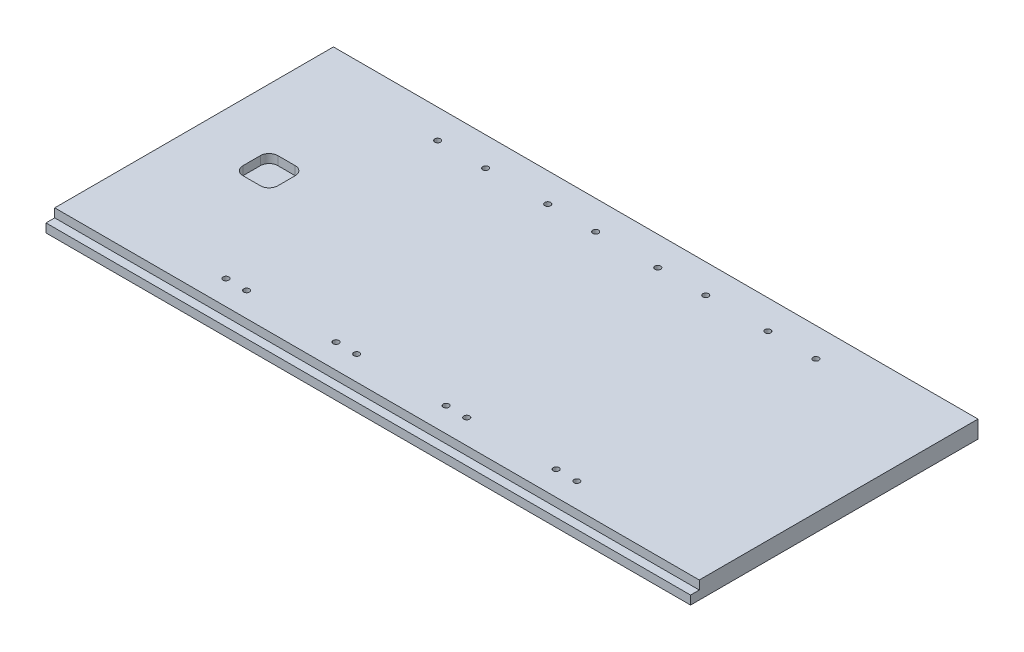
from build123d import *

# Parameters (mm, degrees)
SKETCH3_W           = 469.9
SKETCH3_H           = 209.55
BOSS_EXTRUDE1_DEPTH = 12.7
SKETCH4_R           = 2.1
CUT_EXTRUDE3_DEPTH  = 258.566677047
SKETCH5_R           = 2.1
CUT_EXTRUDE4_DEPTH  = 258.566677047
SKETCH7_W           = 25.4
SKETCH7_H           = 25.4
CUT_EXTRUDE5_DEPTH  = 6.35
CUT_EXTRUDE6_REACH  = 483.607
SKETCH8_W           = 6.35
SKETCH8_H           = 6.35
FILLET1_R           = 6.35


with BuildPart() as part:
    # Sketch3 → Boss-Extrude1 (new body)
    with BuildSketch(Plane(origin=(0, 0, 0), x_dir=(1, 0, 0), z_dir=(0, 1, 0))):
        Rectangle(SKETCH3_W, SKETCH3_H)
    extrude(amount=BOSS_EXTRUDE1_DEPTH)

    # Sketch4 → Cut-Extrude3 (cut, through all)
    with BuildSketch(Plane(origin=(0, 12.7, 0), x_dir=(1, 0, 0), z_dir=(0, 1, 0))):
        with Locations((-102.9, 83.65)):
            Circle(SKETCH4_R)
        with Locations((-22.65, 83.65)):
            Circle(SKETCH4_R)
        with Locations((57.6, 83.65)):
            Circle(SKETCH4_R)
        with Locations((137.85, 83.65)):
            Circle(SKETCH4_R)
        with Locations((112.85, -80.65)):
            Circle(SKETCH4_R)
        with Locations((32.6, -80.65)):
            Circle(SKETCH4_R)
        with Locations((-47.65, -80.65)):
            Circle(SKETCH4_R)
        with Locations((-127.9, -80.65)):
            Circle(SKETCH4_R)
    extrude(amount=-CUT_EXTRUDE3_DEPTH, mode=Mode.SUBTRACT)

    # Sketch5 → Cut-Extrude4 (cut, through all)
    with BuildSketch(Plane(origin=(0, 12.7, 0), x_dir=(1, 0, 0), z_dir=(0, 1, 0))):
        with Locations((-137.85, 83.65)):
            Circle(SKETCH5_R)
        with Locations((-57.6, 83.65)):
            Circle(SKETCH5_R)
        with Locations((22.65, 83.65)):
            Circle(SKETCH5_R)
        with Locations((102.9, 83.65)):
            Circle(SKETCH5_R)
        with Locations((-112.85, -80.65)):
            Circle(SKETCH5_R)
        with Locations((-32.6, -80.65)):
            Circle(SKETCH5_R)
        with Locations((47.65, -80.65)):
            Circle(SKETCH5_R)
        with Locations((127.9, -80.65)):
            Circle(SKETCH5_R)
    extrude(amount=-CUT_EXTRUDE4_DEPTH, mode=Mode.SUBTRACT)

    # Sketch7 → Cut-Extrude5 (cut)
    with BuildSketch(Plane(origin=(0, 12.7, 0), x_dir=(1, 0, 0), z_dir=(0, 1, 0))):
        with Locations((-180.25, 3.175)):
            Rectangle(SKETCH7_W, SKETCH7_H)
    extrude(amount=-CUT_EXTRUDE5_DEPTH, mode=Mode.SUBTRACT)

    # Sketch8 → Cut-Extrude6 (cut, up to next)
    with BuildSketch(Plane.ZY.offset(234.95), mode=Mode.PRIVATE) as cut_extrude6_sk1:
        with Locations((101.6, 9.525)):
            Rectangle(SKETCH8_W, SKETCH8_H)
    cut_extrude6_tool1 = extrude(cut_extrude6_sk1.sketch, amount=-CUT_EXTRUDE6_REACH, mode=Mode.PRIVATE) & part.part
    add(cut_extrude6_tool1.solids().sort_by_distance((-234.95, 9.525, 101.6))[0], mode=Mode.SUBTRACT)

    # Fillet1
    fillet1_edges = [part.edges().sort_by_distance(p)[0] for p in [
        (-167.55, 9.525, 9.525),
        (-192.95, 9.525, 9.525),
        (-192.95, 9.525, -15.875),
        (-167.55, 9.525, -15.875),
    ]]
    fillet(fillet1_edges, radius=FILLET1_R)


solid = part.part
